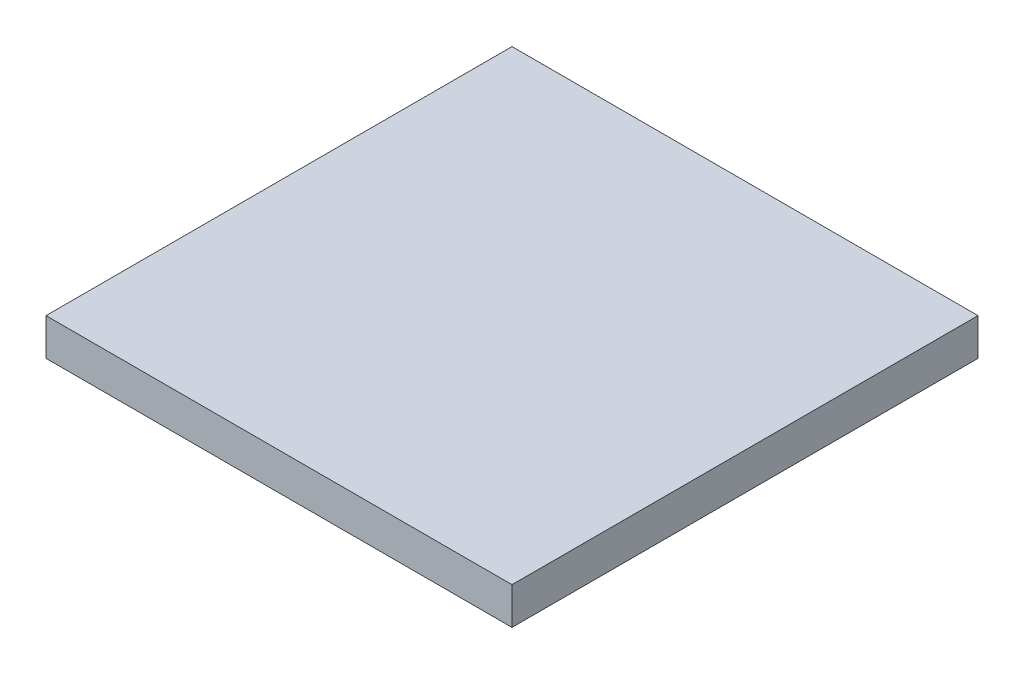
from build123d import *

# Parameters (mm, degrees)
SKETCH1_W           = 914.4
SKETCH1_H           = 914.4
BOSS_EXTRUDE1_DEPTH = 72.644


with BuildPart() as part:
    # Sketch1 → Boss-Extrude1 (new body)
    with BuildSketch(Plane(origin=(0, 0, 0), x_dir=(1, 0, 0), z_dir=(0, 1, 0))):
        Rectangle(SKETCH1_W, SKETCH1_H)
    extrude(amount=BOSS_EXTRUDE1_DEPTH)


solid = part.part
